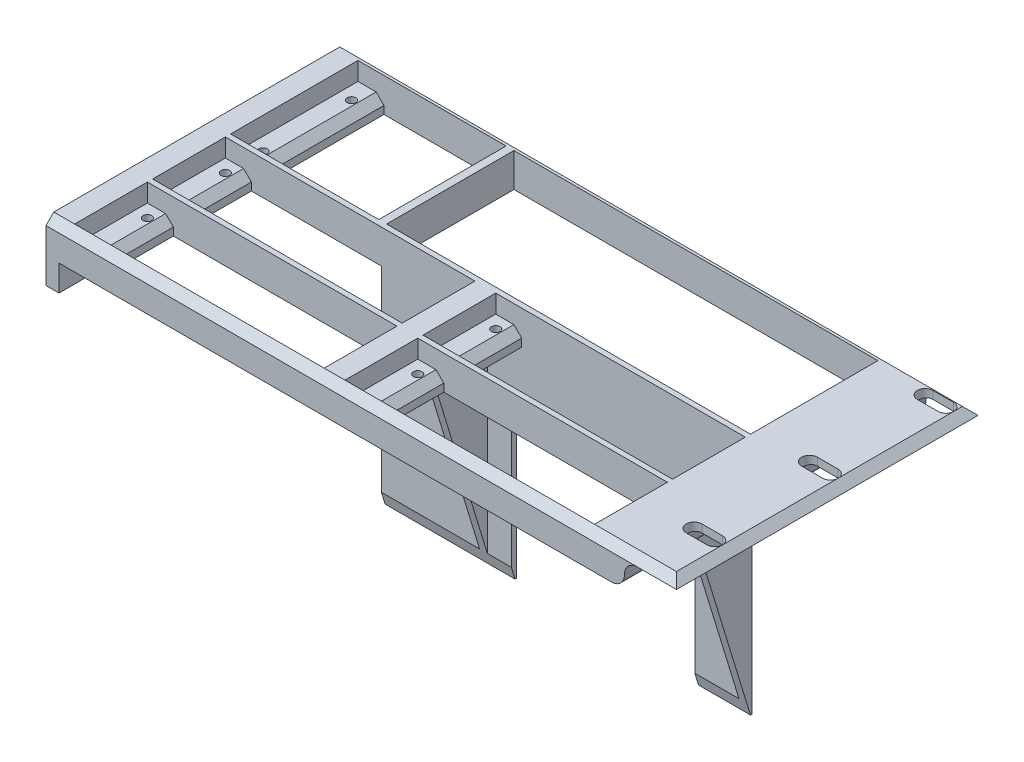
from build123d import *

# Parameters (mm, degrees)
SKETCH1_W                      = 242.5
SKETCH1_H                      = 116
BOSS_EXTRUDE1_DEPTH            = 13
SKETCH32_W                     = 20
SKETCH32_H                     = 116
CUT_EXTRUDE10_DEPTH            = 10
FILLET1_START                  = -59
FILLET1_DEPTH                  = 118
FILLET1_START_2                = -58
FILLET1_2_DEPTH                = 116
SKETCH36_W                     = 96
SKETCH36_H                     = 28
CUT_EXTRUDE11_DEPTH            = 7
SKETCH37_W                     = 76
SKETCH37_H                     = 28
CUT_EXTRUDE12_DEPTH            = 143.489473295
M4X0_7_TAPPED_HOLE1_AT_2_COUNT = 2
M4X0_7_TAPPED_HOLE1_AT_2_PITCH = 18
M4X0_7_TAPPED_HOLE1_AT_3_COUNT = 2
M4X0_7_TAPPED_HOLE1_AT_3_PITCH = 86
M4X0_7_TAPPED_HOLE1_AT_4_COUNT = 2
M4X0_7_TAPPED_HOLE1_AT_4_PITCH = 87.863530546
LPATTERN1_COUNT                = 2
LPATTERN1_PITCH                = 30
LPATTERN1_COUNT_DIR2           = 2
LPATTERN1_PITCH_DIR2           = 104
CHAMFER1_SIZE                  = 3
SKETCH41_W                     = 140
SKETCH41_H                     = 49
CUT_EXTRUDE13_DEPTH            = 30
BOSS_EXTRUDE2_DEPTH            = 80
SKETCH43_W                     = 57
SKETCH43_H                     = 49
CUT_EXTRUDE14_DEPTH            = 7
SKETCH44_W                     = 37
SKETCH44_H                     = 49
CUT_EXTRUDE15_DEPTH            = 17
CHAMFER2_SIZE                  = 3
M4X0_7_TAPPED_HOLE2_D          = 3.3
M4X0_7_TAPPED_HOLE2_DEPTH      = 10.1
M4X0_7_TAPPED_HOLE2_TIP        = 0.991420021
CHAMFER3_SIZE                  = 70
CHAMFER3_SIZE2                 = 21.401147702
SKETCH48_W                     = 5
SKETCH48_H                     = 116
BOSS_EXTRUDE3_DEPTH            = 10
SKETCH49_W                     = 70.567921878
SKETCH49_H                     = 64.139989259
CUT_EXTRUDE16_DEPTH            = 10
M4X0_7_TAPPED_HOLE3_D          = 3.3
M4X0_7_TAPPED_HOLE3_DEPTH      = 5
CUT_EXTRUDE17_DEPTH            = 170.656270146


with BuildPart() as part:
    # Sketch1 → Boss-Extrude1 (new body)
    with BuildSketch(Plane(origin=(0, 0, 0), x_dir=(1, 0, 0), z_dir=(0, 1, 0))):
        with Locations((8.25, 0)):
            Rectangle(SKETCH1_W, SKETCH1_H)
    extrude(amount=BOSS_EXTRUDE1_DEPTH)

    # Sketch32 → Cut-Extrude10 (cut)
    with BuildSketch(Plane.XZ):
        with Locations((119.5, 0)):
            Rectangle(SKETCH32_W, SKETCH32_H)
    extrude(amount=-CUT_EXTRUDE10_DEPTH, mode=Mode.SUBTRACT)

    # Fillet1: read off the stored shape, not the designer's step
    # Fillet1 outline → Fillet1 (cut)
    with BuildSketch(Plane.XY.offset(FILLET1_START)):
        with BuildLine():
            Line((109.5, 0), (109.5, 5))
            ThreePointArc((109.5, 5), (108.035533906, 1.464466094), (104.5, 0))
            Line((104.5, 0), (109.5, 0))
        make_face()
    extrude(amount=FILLET1_DEPTH, mode=Mode.SUBTRACT)

    # Fillet1 2 outline → Fillet1 2 (add)
    with BuildSketch(Plane.XY.offset(FILLET1_START_2)):
        with BuildLine():
            ThreePointArc((109.5, 5), (110.964466094, 8.535533906), (114.5, 10))
            Line((114.5, 10), (109.5, 10))
            Line((109.5, 10), (109.5, 5))
        make_face()
    extrude(amount=FILLET1_2_DEPTH)

    # Sketch36 → Cut-Extrude11 (cut)
    with BuildSketch(Plane(origin=(0, 13, 0), x_dir=(1, 0, 0), z_dir=(0, 1, 0))):
        with Locations((-57, -41)):
            Rectangle(SKETCH36_W, SKETCH36_H)
        with Locations((-57, -11)):
            Rectangle(SKETCH36_W, SKETCH36_H)
        with Locations((47, -11)):
            Rectangle(SKETCH36_W, SKETCH36_H)
        with Locations((47, -41)):
            Rectangle(SKETCH36_W, SKETCH36_H)
    extrude(amount=-CUT_EXTRUDE11_DEPTH, mode=Mode.SUBTRACT)

    # Sketch37 → Cut-Extrude12 (cut, through all)
    with BuildSketch(Plane(origin=(0, 13, 0), x_dir=(1, 0, 0), z_dir=(0, 1, 0))):
        with Locations((-57, -41)):
            Rectangle(SKETCH37_W, SKETCH37_H)
        with Locations((-57, -11)):
            Rectangle(SKETCH37_W, SKETCH37_H)
        with Locations((47, -11)):
            Rectangle(SKETCH37_W, SKETCH37_H)
        with Locations((47, -41)):
            Rectangle(SKETCH37_W, SKETCH37_H)
    extrude(amount=-CUT_EXTRUDE12_DEPTH, mode=Mode.SUBTRACT)

    # Sketch39 → M4x0.7 Tapped Hole1 (revolve, cut)
    with BuildSketch(Plane(origin=(-100, 6, 50), x_dir=(0, 0, 1), z_dir=(1, 0, 0))):
        Polygon((0, 0), (0, 11.091420021), (1.65, 10.1), (1.65, 0), align=None)
    m4x0_7_tapped_hole1 = revolve(axis=Axis((-100, 12.35, 50), (0, -1, 0)), mode=Mode.SUBTRACT)

    # M4x0.7 Tapped Hole1 at 2: M4x0.7 Tapped Hole1 ×2
    with Locations(*[(0, 0, -i * M4X0_7_TAPPED_HOLE1_AT_2_PITCH) for i in range(1, M4X0_7_TAPPED_HOLE1_AT_2_COUNT)]):
        add(m4x0_7_tapped_hole1, mode=Mode.SUBTRACT)

    # M4x0.7 Tapped Hole1 at 3: M4x0.7 Tapped Hole1 ×2
    with Locations(*[(i * M4X0_7_TAPPED_HOLE1_AT_3_PITCH, 0, 0) for i in range(1, M4X0_7_TAPPED_HOLE1_AT_3_COUNT)]):
        add(m4x0_7_tapped_hole1, mode=Mode.SUBTRACT)

    # M4x0.7 Tapped Hole1 at 4: M4x0.7 Tapped Hole1 ×2
    with Locations(*[Vector(0.9787906252528686, 0, -0.20486315412269346) * (i * M4X0_7_TAPPED_HOLE1_AT_4_PITCH) for i in range(1, M4X0_7_TAPPED_HOLE1_AT_4_COUNT)]):
        add(m4x0_7_tapped_hole1, mode=Mode.SUBTRACT)

    # LPattern1: M4x0.7 Tapped Hole1 2 × 2
    with Locations(*[(j * LPATTERN1_PITCH_DIR2, 0, -i * LPATTERN1_PITCH) for i in range(LPATTERN1_COUNT) for j in range(LPATTERN1_COUNT_DIR2) if (i, j) != (0, 0)]):
        add(m4x0_7_tapped_hole1, mode=Mode.SUBTRACT)

    # LPattern1 copy 1 sketch → LPattern1 copy 1 (revolve, cut)
    with BuildSketch(Plane(origin=(4, 6, 32), x_dir=(0, 0, 1), z_dir=(1, 0, 0))):
        Polygon((0, 0), (0, 11.091420021), (1.65, 10.1), (1.65, 0), align=None)
    revolve(axis=Axis((4, 12.35, 32), (0, -1, 0)), mode=Mode.SUBTRACT)

    # LPattern1 copy 2 sketch → LPattern1 copy 2 (revolve, cut)
    with BuildSketch(Plane(origin=(-100, 6, 2), x_dir=(0, 0, 1), z_dir=(1, 0, 0))):
        Polygon((0, 0), (0, 11.091420021), (1.65, 10.1), (1.65, 0), align=None)
    revolve(axis=Axis((-100, 12.35, 2), (0, -1, 0)), mode=Mode.SUBTRACT)

    # LPattern1 copy 3 sketch → LPattern1 copy 3 (revolve, cut)
    with BuildSketch(Plane(origin=(4, 6, 2), x_dir=(0, 0, 1), z_dir=(1, 0, 0))):
        Polygon((0, 0), (0, 11.091420021), (1.65, 10.1), (1.65, 0), align=None)
    revolve(axis=Axis((4, 12.35, 2), (0, -1, 0)), mode=Mode.SUBTRACT)

    # LPattern1 copy 4 sketch → LPattern1 copy 4 (revolve, cut)
    with BuildSketch(Plane(origin=(90, 6, 50), x_dir=(0, 0, 1), z_dir=(1, 0, 0))):
        Polygon((0, 0), (0, 11.091420021), (1.65, 10.1), (1.65, 0), align=None)
    revolve(axis=Axis((90, 12.35, 50), (0, -1, 0)), mode=Mode.SUBTRACT)

    # LPattern1 copy 5 sketch → LPattern1 copy 5 (revolve, cut)
    with BuildSketch(Plane(origin=(-14, 6, 20), x_dir=(0, 0, 1), z_dir=(1, 0, 0))):
        Polygon((0, 0), (0, 11.091420021), (1.65, 10.1), (1.65, 0), align=None)
    revolve(axis=Axis((-14, 12.35, 20), (0, -1, 0)), mode=Mode.SUBTRACT)

    # LPattern1 copy 6 sketch → LPattern1 copy 6 (revolve, cut)
    with BuildSketch(Plane(origin=(90, 6, 20), x_dir=(0, 0, 1), z_dir=(1, 0, 0))):
        Polygon((0, 0), (0, 11.091420021), (1.65, 10.1), (1.65, 0), align=None)
    revolve(axis=Axis((90, 12.35, 20), (0, -1, 0)), mode=Mode.SUBTRACT)

    # LPattern1 copy 7 sketch → LPattern1 copy 7 (revolve, cut)
    with BuildSketch(Plane(origin=(90, 6, 32), x_dir=(0, 0, 1), z_dir=(1, 0, 0))):
        Polygon((0, 0), (0, 11.091420021), (1.65, 10.1), (1.65, 0), align=None)
    revolve(axis=Axis((90, 12.35, 32), (0, -1, 0)), mode=Mode.SUBTRACT)

    # LPattern1 copy 8 sketch → LPattern1 copy 8 (revolve, cut)
    with BuildSketch(Plane(origin=(-14, 6, 2), x_dir=(0, 0, 1), z_dir=(1, 0, 0))):
        Polygon((0, 0), (0, 11.091420021), (1.65, 10.1), (1.65, 0), align=None)
    revolve(axis=Axis((-14, 12.35, 2), (0, -1, 0)), mode=Mode.SUBTRACT)

    # LPattern1 copy 9 sketch → LPattern1 copy 9 (revolve, cut)
    with BuildSketch(Plane(origin=(90, 6, 2), x_dir=(0, 0, 1), z_dir=(1, 0, 0))):
        Polygon((0, 0), (0, 11.091420021), (1.65, 10.1), (1.65, 0), align=None)
    revolve(axis=Axis((90, 12.35, 2), (0, -1, 0)), mode=Mode.SUBTRACT)

    # Chamfer1
    chamfer1_edges = [part.edges().sort_by_distance(p)[0] for p in [
        (-95, 6, 11),
        (-19, 6, 11),
        (-19, 6, 41),
        (-95, 6, 41),
        (85, 6, 11),
        (9, 6, 11),
        (9, 6, 41),
        (85, 6, 41),
        (8.25, 13, -58),
        (129.5, 13, 0),
        (8.25, 13, 58),
    ]]
    chamfer(chamfer1_edges, length=CHAMFER1_SIZE - 0.0001)  # a hair under: the kernel refuses the full size

    # Sketch41 → Cut-Extrude13 (cut)
    with BuildSketch(Plane(origin=(0, 13, 0), x_dir=(1, 0, 0), z_dir=(0, 1, 0))):
        with Locations((25, 29.5)):
            Rectangle(SKETCH41_W, SKETCH41_H)
    extrude(amount=-CUT_EXTRUDE13_DEPTH, mode=Mode.SUBTRACT)

    # Sketch42 → Boss-Extrude2 (add)
    with BuildSketch(Plane.XZ):
        Polygon((-45, -5), (-45, -3), (-7.207942419, -3), (-7.207942419, 16.976819085), (-4.207942419, 16.976819085), (-4.207942419, -3), (92.567921878, -3), (92.567921878, 16.976819085), (95.567921878, 16.976819085), (95.567921878, -5), align=None)
    extrude(amount=BOSS_EXTRUDE2_DEPTH)

    # Sketch43 → Cut-Extrude14 (cut)
    with BuildSketch(Plane(origin=(0, 13, 0), x_dir=(1, 0, 0), z_dir=(0, 1, 0))):
        with Locations((-76.5, 29.5)):
            Rectangle(SKETCH43_W, SKETCH43_H)
    extrude(amount=-CUT_EXTRUDE14_DEPTH, mode=Mode.SUBTRACT)

    # Sketch44 → Cut-Extrude15 (cut)
    with BuildSketch(Plane(origin=(0, 6, 0), x_dir=(1, 0, 0), z_dir=(0, 1, 0))):
        with Locations((-76.5, 29.5)):
            Rectangle(SKETCH44_W, SKETCH44_H)
    extrude(amount=-CUT_EXTRUDE15_DEPTH, mode=Mode.SUBTRACT)

    # Chamfer2
    chamfer2_edges = [part.edges().sort_by_distance(p)[0] for p in [
        (-95, 6, -29.5),
        (-58, 6, -29.5),
    ]]
    chamfer(chamfer2_edges, length=CHAMFER2_SIZE)

    # M4x0.7 Tapped Hole2
    with Locations(Plane(origin=(0, 6, 0), x_dir=(1, 0, 0), z_dir=(0, 1, 0))):
        with Locations((-100, 12.5), (-100, 46.5), (-53, 46.5), (-53, 12.5)):
            Hole(M4X0_7_TAPPED_HOLE2_D / 2, depth=M4X0_7_TAPPED_HOLE2_DEPTH)
            with Locations((0, 0, -(M4X0_7_TAPPED_HOLE2_DEPTH + M4X0_7_TAPPED_HOLE2_TIP / 2))):  # 118° drill point
                Cone(0, M4X0_7_TAPPED_HOLE2_D / 2, M4X0_7_TAPPED_HOLE2_TIP, mode=Mode.SUBTRACT)

    # Chamfer3
    chamfer3_edges = [part.edges().sort_by_distance(p)[0] for p in [
        (-5.707942419, -80, 16.976819085),
    ]]
    chamfer3_side = [part.faces().sort_by_distance(p)[0] for p in [
        (-5.707942419, -40, 16.976819085),
    ]]
    chamfer(chamfer3_edges, length=CHAMFER3_SIZE, length2=CHAMFER3_SIZE2, reference=chamfer3_side[0])

    # Sketch48 → Boss-Extrude3 (add)
    with BuildSketch(Plane.XZ):
        with Locations((-110.5, 0)):
            Rectangle(SKETCH48_W, SKETCH48_H)
    extrude(amount=BOSS_EXTRUDE3_DEPTH)

    # Sketch49 → Cut-Extrude16 (cut)
    with BuildSketch(Plane(origin=(0, 0, -5), x_dir=(-1, 0, 0), z_dir=(0, 0, -1))):
        with Locations((-40.283960939, -47.93000537)):
            Rectangle(SKETCH49_W, SKETCH49_H)
    extrude(amount=-CUT_EXTRUDE16_DEPTH, mode=Mode.SUBTRACT)

    # M4x0.7 Tapped Hole3
    with Locations(Plane(origin=(-108, 0, 0), x_dir=(0, 0, -1), z_dir=(1, 0, 0))):
        with Locations((15, -4.5), (45, -4.5), (-15, -4.5), (-45, -4.5)):
            Hole(M4X0_7_TAPPED_HOLE3_D / 2, depth=M4X0_7_TAPPED_HOLE3_DEPTH)

    # Sketch53 → Cut-Extrude17 (cut, through all)
    with BuildSketch(Plane(origin=(0, 13, 0), x_dir=(1, 0, 0), z_dir=(0, 1, 0))):
        with BuildLine():
            Line((123.5, 48.65), (115.5, 48.65))
            ThreePointArc((115.5, 48.65), (112.5, 51.65), (115.5, 54.65))
            Line((115.5, 54.65), (123.5, 54.65))
            ThreePointArc((123.5, 54.65), (126.5, 51.65), (123.5, 48.65))
        make_face()
        with BuildLine():
            Line((123.5, 4.2), (115.5, 4.2))
            ThreePointArc((115.5, 4.2), (112.5, 7.2), (115.5, 10.2))
            Line((115.5, 10.2), (123.5, 10.2))
            ThreePointArc((123.5, 10.2), (126.5, 7.2), (123.5, 4.2))
        make_face()
        with BuildLine():
            Line((123.5, -40.25), (115.5, -40.25))
            ThreePointArc((115.5, -40.25), (112.5, -37.25), (115.5, -34.25))
            Line((115.5, -34.25), (123.5, -34.25))
            ThreePointArc((123.5, -34.25), (126.5, -37.25), (123.5, -40.25))
        make_face()
    extrude(amount=-CUT_EXTRUDE17_DEPTH, mode=Mode.SUBTRACT)


solid = part.part
